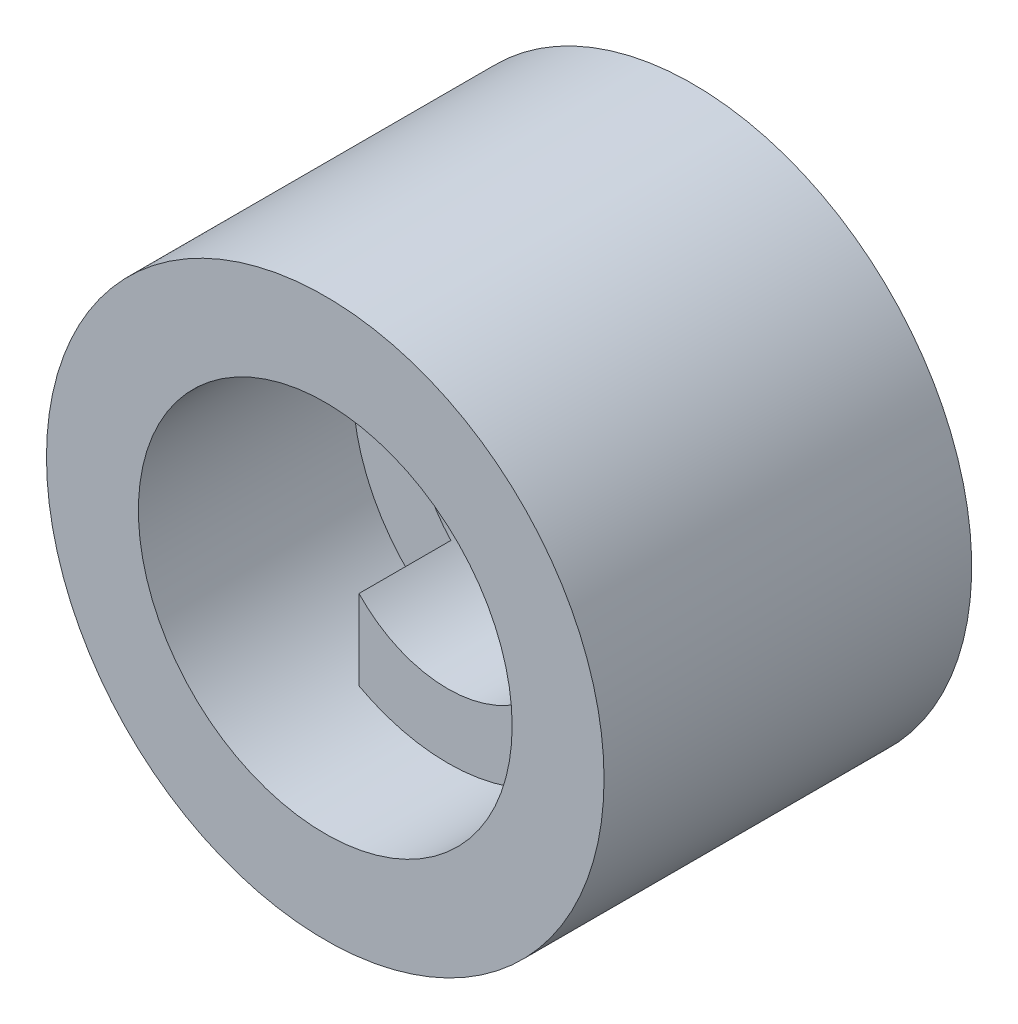
from build123d import *

# Parameters (mm, degrees)
CROQUIS1_R              = 9.1
CROQUIS1_R_2            = 6.1
SALIENTE_EXTRUIR1_DEPTH = 7
SALIENTE_EXTRUIR2_DEPTH = 3
SALIENTE_EXTRUIR3_START = 5
CROQUIS3_R              = 9.1
SALIENTE_EXTRUIR3_DEPTH = 5
CROQUIS4_R              = 4
CORTAR_EXTRUIR1_DEPTH   = 23


with BuildPart() as part:
    # Croquis1 → Saliente-Extruir1 (new body)
    with BuildSketch(Plane.XY):
        Circle(CROQUIS1_R)
        Circle(CROQUIS1_R_2, mode=Mode.SUBTRACT)
    extrude(amount=SALIENTE_EXTRUIR1_DEPTH)

    # Croquis2 → Saliente-Extruir2 (add)
    with BuildSketch(Plane.XY):
        with BuildLine():
            Line((-2.9, 5.366563146), (-2.9, -5.366563146))
            ThreePointArc((-2.9, -5.366563146), (0, -6.1), (2.9, -5.366563146))
            Line((2.9, -5.366563146), (2.9, 5.366563146))
            ThreePointArc((2.9, 5.366563146), (0, 6.1), (-2.9, 5.366563146))
        make_face()
    extrude(amount=SALIENTE_EXTRUIR2_DEPTH)

    # Croquis3 → Saliente-Extruir3 (add)
    with BuildSketch(Plane(origin=(0, 0, 0), x_dir=(-1, 0, 0), z_dir=(0, 0, -1)).offset(SALIENTE_EXTRUIR3_START)):
        Circle(CROQUIS3_R)
    extrude(amount=-SALIENTE_EXTRUIR3_DEPTH)

    # Croquis4 → Cortar-Extruir1 (cut)
    with BuildSketch(Plane(origin=(0, 0, -5), x_dir=(-1, 0, 0), z_dir=(0, 0, -1))):
        Circle(CROQUIS4_R)
    extrude(amount=-CORTAR_EXTRUIR1_DEPTH, mode=Mode.SUBTRACT)


solid = part.part
